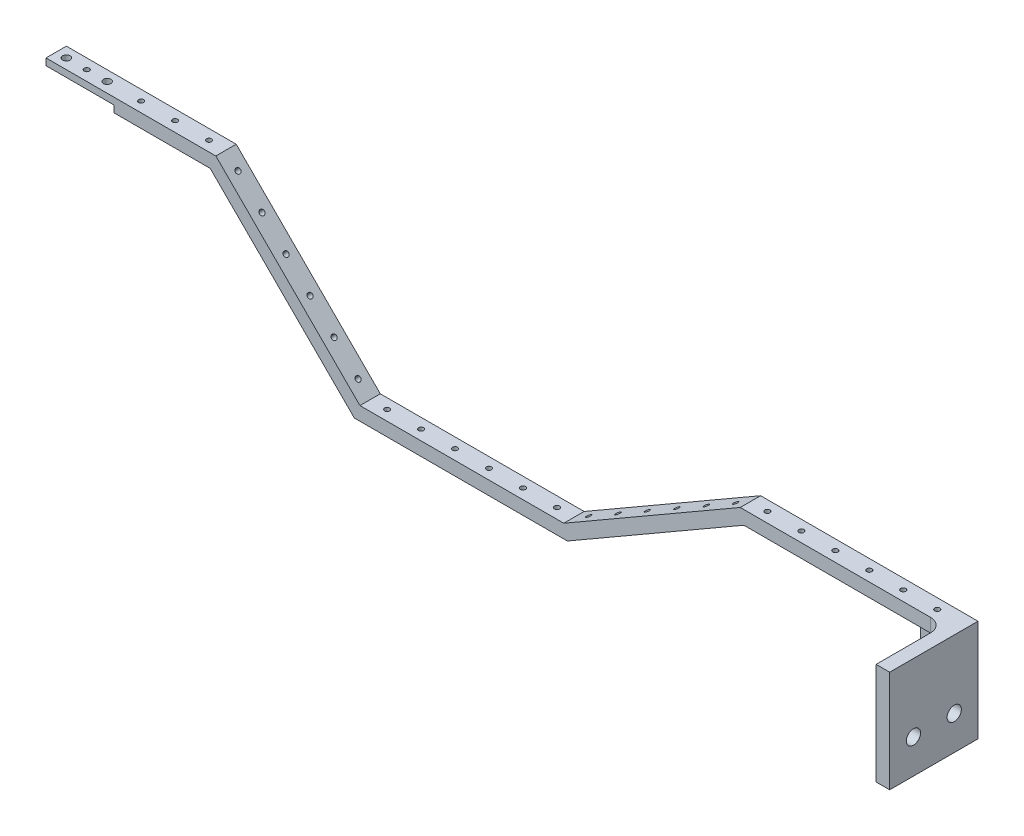
from build123d import *

# Parameters (mm, degrees)
BOSS_EXTRUDE1_DEPTH = 6
SKETCH3_W           = 20
SKETCH3_H           = 2
CUT_EXTRUDE1_DEPTH  = 6
SKETCH4_R           = 0.75
CUT_EXTRUDE2_DEPTH  = 171.094917366
SKETCH5_R           = 0.75
CUT_EXTRUDE3_DEPTH  = 152.577812455
SKETCH6_R           = 0.75
CUT_EXTRUDE4_DEPTH  = 172.977559331
SKETCH7_R           = 0.75
CUT_EXTRUDE5_DEPTH  = 190.504855499
SKETCH9_R           = 0.75
CUT_EXTRUDE6_DEPTH  = 12
SKETCH10_R          = 1.1
CUT_EXTRUDE7_DEPTH  = 12
SKETCH11_R          = 1.1
CUT_EXTRUDE8_DEPTH  = 12
SKETCH12_R          = 0.75
CUT_EXTRUDE9_DEPTH  = 12
SKETCH15_W          = 20
SKETCH15_H          = 30
BOSS_EXTRUDE4_DEPTH = 4
FILLET4_R           = 4
SKETCH16_W          = 15
SKETCH16_H          = 30
BOSS_EXTRUDE5_DEPTH = 2
FILLET5_R           = 3
FILLET6_DEPTH       = 1.9999999
FILLET6_START       = 148.554137986
FILLET6_2_DEPTH     = 3.0000001
FILLET6_START_2     = 1.99999999
FILLET6_3_DEPTH     = 3.00000001
SKETCH17_R          = 2.1
CUT_EXTRUDE12_DEPTH = 4


with BuildPart() as part:
    # Sketch1 → Boss-Extrude1 (new body)
    with BuildSketch(Plane.XY):
        Polygon((166.554138086, -30.981559499), (166.554138086, -0.981559499), (102.554138086, -0.981559499), (50.592613859, -30.981559499), (-9.407386141, -30.981559499), (-51.833793012, 11.444847372), (-101.833793012, 11.444847372), (-101.833793012, 7.444847372), (-53.490647262, 7.444847372), (-11.06424039, -34.981559499), (51.664410629, -34.981559499), (103.625934856, -4.981559499), (162.554138086, -4.981559499), (162.554138086, -30.981559499), align=None)
    extrude(amount=BOSS_EXTRUDE1_DEPTH)

    # Sketch3 → Cut-Extrude1 (cut)
    with BuildSketch(Plane.XY.offset(6)):
        with Locations((-91.833793012, 8.444847372)):
            Rectangle(SKETCH3_W, SKETCH3_H)
    extrude(amount=-CUT_EXTRUDE1_DEPTH, mode=Mode.SUBTRACT)

    # Sketch4 → Cut-Extrude2 (cut, through all)
    with BuildSketch(Plane(origin=(0, -0.981559499, 0), x_dir=(1, 0, 0), z_dir=(0, 1, 0))):
        with Locations(Location((107.554138086, -3, 0), (0, 0, 180))):
            Circle(SKETCH4_R)
        with Locations(Location((117.554138086, -3, 0), (0, 0, 180))):
            Circle(SKETCH4_R)
        with Locations(Location((127.554138086, -3, 0), (0, 0, 180))):
            Circle(SKETCH4_R)
        with Locations(Location((137.554138086, -3, 0), (0, 0, 180))):
            Circle(SKETCH4_R)
        with Locations(Location((147.554138086, -3, 0), (0, 0, 180))):
            Circle(SKETCH4_R)
        with Locations(Location((157.554138086, -3, 0), (0, 0, 180))):
            Circle(SKETCH4_R)
    extrude(amount=-CUT_EXTRUDE2_DEPTH, mode=Mode.SUBTRACT)

    # Sketch5 → Cut-Extrude3 (cut, through all)
    with BuildSketch(Plane(origin=(26.063562252, -45.143414047, 0), x_dir=(0.8660254037844379, 0.5000000000000013, 0), z_dir=(-0.5000000000000013, 0.8660254037844379, 0))):
        with Locations(Location((33.323709096, -3, 0), (0, 0, 180))):
            Circle(SKETCH5_R)
        with Locations(Location((43.323709096, -3, 0), (0, 0, 180))):
            Circle(SKETCH5_R)
        with Locations(Location((53.323709096, -3, 0), (0, 0, 180))):
            Circle(SKETCH5_R)
        with Locations(Location((63.323709096, -3, 0), (0, 0, 180))):
            Circle(SKETCH5_R)
        with Locations(Location((73.323709096, -3, 0), (0, 0, 180))):
            Circle(SKETCH5_R)
        with Locations(Location((83.323709096, -3, 0), (0, 0, 180))):
            Circle(SKETCH5_R)
    extrude(amount=-CUT_EXTRUDE3_DEPTH, mode=Mode.SUBTRACT)

    # Sketch6 → Cut-Extrude4 (cut, through all)
    with BuildSketch(Plane(origin=(0, -30.981559499, 0), x_dir=(1, 0, 0), z_dir=(0, 1, 0))):
        with Locations(Location((45.592613859, -3, 0), (0, 0, 180))):
            Circle(SKETCH6_R)
        with Locations(Location((35.592613859, -3, 0), (0, 0, 180))):
            Circle(SKETCH6_R)
        with Locations(Location((25.592613859, -3, 0), (0, 0, 180))):
            Circle(SKETCH6_R)
        with Locations(Location((15.592613859, -3, 0), (0, 0, 180))):
            Circle(SKETCH6_R)
        with Locations(Location((5.592613859, -3, 0), (0, 0, 180))):
            Circle(SKETCH6_R)
        with Locations(Location((-4.407386141, -3, 0), (0, 0, 180))):
            Circle(SKETCH6_R)
    extrude(amount=-CUT_EXTRUDE4_DEPTH, mode=Mode.SUBTRACT)

    # Sketch7 → Cut-Extrude5 (cut, through all)
    with BuildSketch(Plane(origin=(-20.19447282, -20.19447282, 0), x_dir=(0, 0, -1), z_dir=(0.7071067811865487, 0.7071067811865464, 0))):
        with Locations(Location((-3, -10.25524428, 0), (0, 0, 90))):
            Circle(SKETCH7_R)
        with Locations(Location((-3, -0.25524428, 0), (0, 0, 90))):
            Circle(SKETCH7_R)
        with Locations(Location((-3, 9.74475572, 0), (0, 0, 90))):
            Circle(SKETCH7_R)
        with Locations(Location((-3, 19.74475572, 0), (0, 0, 90))):
            Circle(SKETCH7_R)
        with Locations(Location((-3, 29.74475572, 0), (0, 0, 90))):
            Circle(SKETCH7_R)
        with Locations(Location((-3, 39.74475572, 0), (0, 0, 90))):
            Circle(SKETCH7_R)
    extrude(amount=-CUT_EXTRUDE5_DEPTH, mode=Mode.SUBTRACT)

    # Sketch9 → Cut-Extrude6 (cut)
    with BuildSketch(Plane(origin=(0, 11.444847372, 0), x_dir=(1, 0, 0), z_dir=(0, 1, 0))):
        with Locations(Location((-56.833793012, -3, 0), (0, 0, 180))):
            Circle(SKETCH9_R)
        with Locations(Location((-66.833793012, -3, 0), (0, 0, 180))):
            Circle(SKETCH9_R)
        with Locations(Location((-76.833793012, -3, 0), (0, 0, 180))):
            Circle(SKETCH9_R)
    extrude(amount=-CUT_EXTRUDE6_DEPTH, mode=Mode.SUBTRACT)

    # Sketch10 → Cut-Extrude7 (cut)
    with BuildSketch(Plane.XZ.offset(-9.444847372)):
        with Locations(Location((-98.833793012, 3, 0), (0, 0, 270))):
            Circle(SKETCH10_R)
    extrude(amount=-CUT_EXTRUDE7_DEPTH, mode=Mode.SUBTRACT)

    # Sketch11 → Cut-Extrude8 (cut)
    with BuildSketch(Plane.XZ.offset(-9.444847372)):
        with Locations(Location((-86.833793012, 3, 0), (0, 0, 270))):
            Circle(SKETCH11_R)
    extrude(amount=-CUT_EXTRUDE8_DEPTH, mode=Mode.SUBTRACT)

    # Sketch12 → Cut-Extrude9 (cut)
    with BuildSketch(Plane.XZ.offset(-9.444847372)):
        with Locations(Location((-92.833793012, 3, 0), (0, 0, 270))):
            Circle(SKETCH12_R)
    extrude(amount=-CUT_EXTRUDE9_DEPTH, mode=Mode.SUBTRACT)

    # Sketch15 → Boss-Extrude4 (add)
    with BuildSketch(Plane(origin=(166.554138086, 0, 0), x_dir=(0, 0, -1), z_dir=(1, 0, 0))):
        with Locations((-16, -15.981559499)):
            Rectangle(SKETCH15_W, SKETCH15_H)
    extrude(amount=-BOSS_EXTRUDE4_DEPTH)

    # Fillet4
    fillet4_edges = [part.edges().sort_by_distance(p)[0] for p in [
        (162.554138086, -2.981559499, 6),
        (162.554138086, -4.981559499, 3),
    ]]
    fillet(fillet4_edges, radius=FILLET4_R)

    # Sketch16 → Boss-Extrude5 (add)
    with BuildSketch(Plane(origin=(0, 0, 0), x_dir=(-1, 0, 0), z_dir=(0, 0, -1))):
        with Locations((-159.054138086, -15.981559499)):
            Rectangle(SKETCH16_W, SKETCH16_H)
    extrude(amount=-BOSS_EXTRUDE5_DEPTH)

    # Fillet5
    # the kernel refuses this fillet: 3 mm, written as the material it adds along each edge
    with BuildSketch(Plane(origin=(158.554138086, -8.981559499, 2), x_dir=(1, 0, 0), z_dir=(0, -1, 0))) as fillet5_piece_1:
        with BuildLine():
            CenterArc((4 - FILLET5_R, FILLET5_R), FILLET5_R, 270, 90)
            Line((4, FILLET5_R), (4, 0))
            Line((4, 0), (4 - FILLET5_R, 0))
        make_face()
    revolve(axis=Axis((158.554138086, -8.981559499, 2), (0, 0, 1)), revolution_arc=90)
    with BuildSketch(Plane(origin=(151.554138086, -4.981559499, 2), x_dir=(0, -1, 0), z_dir=(1, 0, 0))) as fillet5_piece_2_section:
        with BuildLine():
            CenterArc((FILLET5_R, -FILLET5_R), FILLET5_R, 90, 90)
            Line((0, -FILLET5_R), (0, 0))
            Line((0, 0), (FILLET5_R, 0))
        make_face()
    fillet5_piece_2 = extrude(amount=7, mode=Mode.PRIVATE)
    fillet5_piece_2 = fillet5_piece_2 - Plane(origin=(157.554138086, -4.981559499, 3), x_dir=(-1, 0, 0), z_dir=(0, 1, 0)) * Cylinder(0.75, 27, mode=Mode.PRIVATE)
    add(fillet5_piece_2)
    with BuildSketch(Plane(origin=(162.554138086, -8.981559499, 2), x_dir=(0, 0, 1), z_dir=(0, -1, 0))) as fillet5_piece_3:
        with BuildLine():
            CenterArc((FILLET5_R, FILLET5_R), FILLET5_R, 180, 90)
            Line((0, FILLET5_R), (0, 0))
            Line((0, 0), (FILLET5_R, 0))
        make_face()
    extrude(amount=22)

    # Fillet6: read off the stored shape, not the designer's step
    # Fillet6 outline → Fillet6 (add)
    with BuildSketch(Plane.XY):
        with BuildLine():
            ThreePointArc((148.554138086, -4.981559499), (150.67545843, -5.860239155), (151.554138086, -7.981559499))
            Line((151.554138086, -7.981559499), (151.554138086, -4.981559499))
            Line((151.554138086, -4.981559499), (148.554138086, -4.981559499))
        make_face()
    extrude(amount=FILLET6_DEPTH)

    # Fillet6 2 outline → Fillet6 2 (add)
    with BuildSketch(Plane.YZ.offset(FILLET6_START)):
        with BuildLine():
            ThreePointArc((-4.981559499, 5), (-5.860239155, 2.878679656), (-7.981559499, 2))
            Line((-7.981559499, 2), (-4.981559499, 1.9999999))
            Line((-4.981559499, 1.9999999), (-4.981559499, 5))
        make_face()
    extrude(amount=FILLET6_2_DEPTH)

    # Fillet6 3 outline → Fillet6 3 (cut)
    with BuildSketch(Plane.XY.offset(FILLET6_START_2)):
        with BuildLine():
            Line((151.554138085, -9), (151.554138086, -7.981559499))
            ThreePointArc((151.554138086, -7.981559499), (150.67545843, -5.860239155), (148.554138086, -4.981559499))
            Line((148.554138086, -4.981559499), (148.554137986, -9))
            Line((148.554137986, -9), (151.554138085, -9))
        make_face()
    extrude(amount=FILLET6_3_DEPTH, mode=Mode.SUBTRACT)

    # Sketch17 → Cut-Extrude12 (cut)
    with BuildSketch(Plane(origin=(166.554138086, 0, 0), x_dir=(0, 0, -1), z_dir=(1, 0, 0))):
        with Locations(Location((-19, -20.981559499, 0), (0, 0, 90))):
            Circle(SKETCH17_R)
        with Locations(Location((-7, -20.981559499, 0), (0, 0, 90))):
            Circle(SKETCH17_R)
    extrude(amount=-CUT_EXTRUDE12_DEPTH, mode=Mode.SUBTRACT)


solid = part.part
